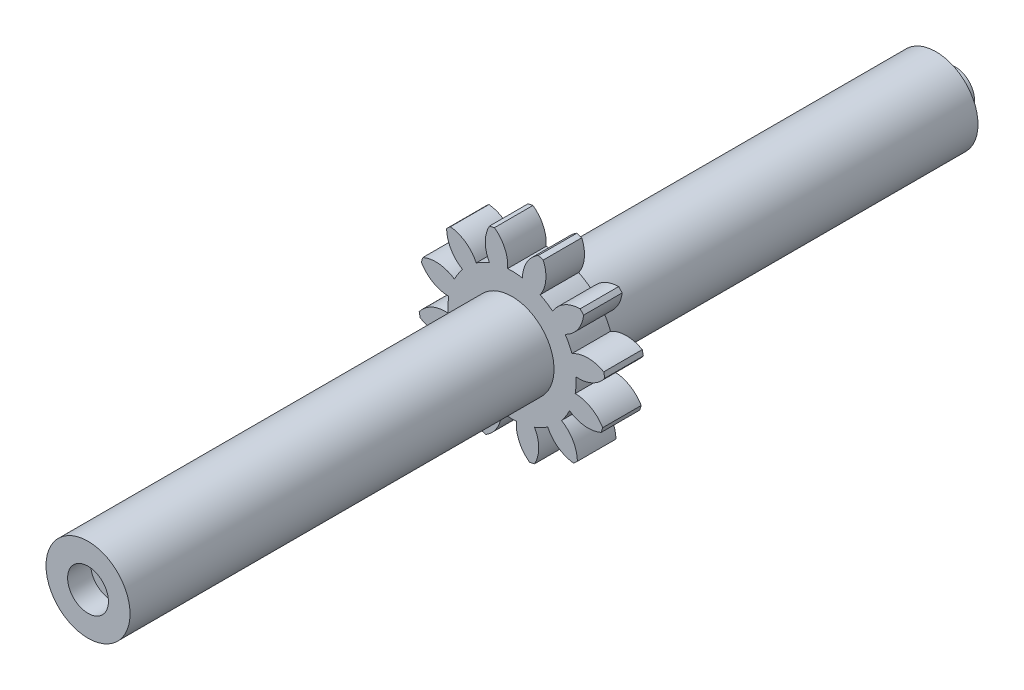
from build123d import *

# Parameters (mm, degrees)
SKETCH1_R           = 5.45
BOSS_EXTRUDE1_DEPTH = 110
SKETCH6_R           = 2.5
BOSS_EXTRUDE2_DEPTH = 2.5
SKETCH7_R           = 2.65
CUT_EXTRUDE1_DEPTH  = 3
JOIN1_START         = 50
JOIN1_DEPTH         = 5


# Read off the part's stored shape, not the designer's step: Join1
with BuildPart() as part:
    # Sketch1 → Boss-Extrude1 (new body)
    with BuildSketch(Plane.XY):
        Circle(SKETCH1_R)
    extrude(amount=BOSS_EXTRUDE1_DEPTH)

    # Sketch6 → Boss-Extrude2 (add)
    with BuildSketch(Plane(origin=(0, 0, 0), x_dir=(-1, 0, 0), z_dir=(0, 0, -1))):
        Circle(SKETCH6_R)
    extrude(amount=BOSS_EXTRUDE2_DEPTH)

    # Sketch7 → Cut-Extrude1 (cut)
    with BuildSketch(Plane.XY.offset(110)):
        Circle(SKETCH7_R)
    extrude(amount=-CUT_EXTRUDE1_DEPTH, mode=Mode.SUBTRACT)

    # Join1 outline → Join1 (add)
    with BuildSketch(Plane.XY.offset(JOIN1_START)):
        with BuildLine():
            ThreePointArc((-9.285244381, -7.990415307), (-9.065544683, -8.238834845), (-8.839200881, -8.481216173))
            ThreePointArc((-8.839200881, -8.481216173), (-6.788114029, -7.918067874), (-5.275945069, -6.422260963))
            ThreePointArc((-5.275945069, -6.422260963), (-4.494503923, -6.991456696), (-3.652254242, -7.466061291))
            ThreePointArc((-3.652254242, -7.466061291), (-4.385263154, -9.462756364), (-4.046049861, -11.562524833))
            ThreePointArc((-4.046049861, -11.562524833), (-3.731574572, -11.667812615), (-3.414364426, -11.764549102))
            ThreePointArc((-3.414364426, -11.764549102), (-1.919645256, -10.251304943), (-1.357971977, -8.199813678))
            ThreePointArc((-1.357971977, -8.199813678), (-0.396626227, -8.30203107), (0.570085691, -8.291925865))
            ThreePointArc((0.570085691, -8.291925865), (0.933628889, -10.387618978), (2.277280452, -12.036465168))
            ThreePointArc((2.277280452, -12.036465168), (2.602267932, -11.970409417), (2.92534822, -11.895580599))
            ThreePointArc((2.92534822, -11.895580599), (3.463190913, -9.83771313), (2.923868609, -7.78023294))
            ThreePointArc((2.923868609, -7.78023294), (3.807527147, -7.388082923), (4.639671624, -6.8959756))
            ThreePointArc((4.639671624, -6.8959756), (6.002355825, -8.529127476), (7.990415307, -9.285244381))
            ThreePointArc((7.990415307, -9.285244381), (8.238834845, -9.065544683), (8.481216173, -8.839200881))
            ThreePointArc((8.481216173, -8.839200881), (7.918067874, -6.788114029), (6.422260963, -5.275945069))
            ThreePointArc((6.422260963, -5.275945069), (6.991456696, -4.494503923), (7.466061291, -3.652254242))
            ThreePointArc((7.466061291, -3.652254242), (9.462756364, -4.385263154), (11.562524833, -4.046049861))
            ThreePointArc((11.562524833, -4.046049861), (11.667812615, -3.731574572), (11.764549102, -3.414364426))
            ThreePointArc((11.764549102, -3.414364426), (10.251304943, -1.919645256), (8.199813678, -1.357971977))
            ThreePointArc((8.199813678, -1.357971977), (8.30203107, -0.396626227), (8.291925865, 0.570085691))
            ThreePointArc((8.291925865, 0.570085691), (10.387618978, 0.933628889), (12.036465168, 2.277280452))
            ThreePointArc((12.036465168, 2.277280452), (11.970409417, 2.602267932), (11.895580599, 2.92534822))
            ThreePointArc((11.895580599, 2.92534822), (9.83771313, 3.463190913), (7.78023294, 2.923868609))
            ThreePointArc((7.78023294, 2.923868609), (7.388082923, 3.807527147), (6.8959756, 4.639671624))
            ThreePointArc((6.8959756, 4.639671624), (8.529127476, 6.002355825), (9.285244381, 7.990415307))
            ThreePointArc((9.285244381, 7.990415307), (9.065544683, 8.238834845), (8.839200881, 8.481216173))
            ThreePointArc((8.839200881, 8.481216173), (6.788114029, 7.918067874), (5.275945069, 6.422260963))
            ThreePointArc((5.275945069, 6.422260963), (4.494503923, 6.991456696), (3.652254242, 7.466061291))
            ThreePointArc((3.652254242, 7.466061291), (4.385263154, 9.462756364), (4.046049861, 11.562524833))
            ThreePointArc((4.046049861, 11.562524833), (3.731574572, 11.667812615), (3.414364426, 11.764549102))
            ThreePointArc((3.414364426, 11.764549102), (1.919645256, 10.251304943), (1.357971977, 8.199813678))
            ThreePointArc((1.357971977, 8.199813678), (0.396626227, 8.30203107), (-0.570085691, 8.291925865))
            ThreePointArc((-0.570085691, 8.291925865), (-0.933628889, 10.387618978), (-2.277280452, 12.036465168))
            ThreePointArc((-2.277280452, 12.036465168), (-2.602267932, 11.970409417), (-2.92534822, 11.895580599))
            ThreePointArc((-2.92534822, 11.895580599), (-3.463190913, 9.83771313), (-2.923868609, 7.78023294))
            ThreePointArc((-2.923868609, 7.78023294), (-3.807527147, 7.388082923), (-4.639671624, 6.8959756))
            ThreePointArc((-4.639671624, 6.8959756), (-6.002355825, 8.529127476), (-7.990415307, 9.285244381))
            ThreePointArc((-7.990415307, 9.285244381), (-8.238834845, 9.065544683), (-8.481216173, 8.839200881))
            ThreePointArc((-8.481216173, 8.839200881), (-7.918067874, 6.788114029), (-6.422260963, 5.275945069))
            ThreePointArc((-6.422260963, 5.275945069), (-6.991456696, 4.494503923), (-7.466061291, 3.652254242))
            ThreePointArc((-7.466061291, 3.652254242), (-9.462756364, 4.385263154), (-11.562524833, 4.046049861))
            ThreePointArc((-11.562524833, 4.046049861), (-11.667812615, 3.731574572), (-11.764549102, 3.414364426))
            ThreePointArc((-11.764549102, 3.414364426), (-10.251304943, 1.919645256), (-8.199813678, 1.357971977))
            ThreePointArc((-8.199813678, 1.357971977), (-8.30203107, 0.396626227), (-8.291925865, -0.570085691))
            ThreePointArc((-8.291925865, -0.570085691), (-10.387618978, -0.933628889), (-12.036465168, -2.277280452))
            ThreePointArc((-12.036465168, -2.277280452), (-11.970409417, -2.602267932), (-11.895580599, -2.92534822))
            ThreePointArc((-11.895580599, -2.92534822), (-9.83771313, -3.463190913), (-7.78023294, -2.923868609))
            ThreePointArc((-7.78023294, -2.923868609), (-7.388082923, -3.807527147), (-6.8959756, -4.639671624))
            ThreePointArc((-6.8959756, -4.639671624), (-8.529127476, -6.002355825), (-9.285244381, -7.990415307))
        make_face()
    extrude(amount=JOIN1_DEPTH)


solid = part.part
